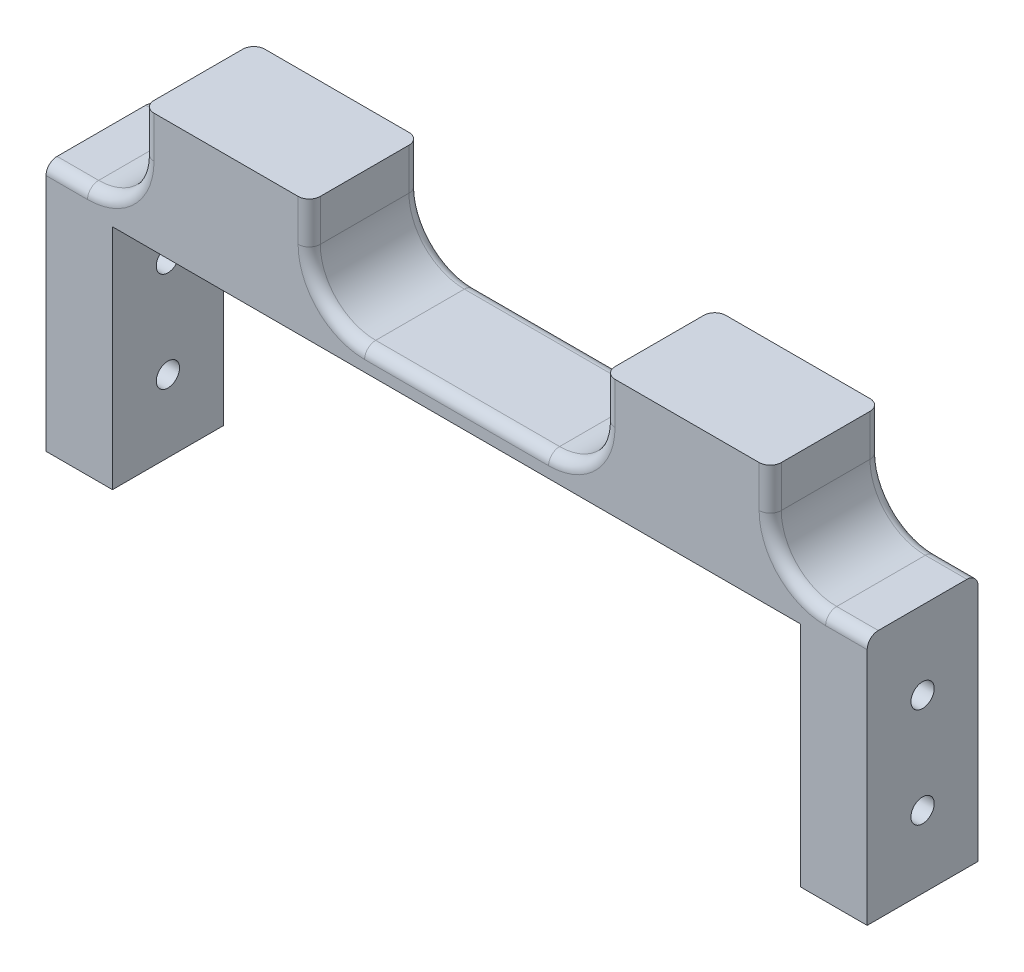
from build123d import *

# Parameters (mm, degrees)
BOSS_EXTRUDE1_DEPTH  = 20
SKETCH2_R            = 2.1
CUT_EXTRUDE1_DEPTH   = 149
SKETCH3_W            = 30
SKETCH3_H            = 17.5
BOSS_EXTRUDE2_DEPTH  = 20
FILLET1_R            = 10
FILLET1_OF_MIRROR1_R = 10
FILLET2_R            = 2


with BuildPart() as part:
    # Sketch1 → Boss-Extrude1 (new body)
    with BuildSketch(Plane.XY):
        Polygon((62.1, 20.55), (62.1, -20.55), (74.1, -20.55), (74.1, 24.55), (-74.1, 24.55), (-74.1, -20.55), (-62.1, -20.55), (-62.1, 20.55), align=None)
    extrude(amount=BOSS_EXTRUDE1_DEPTH)

    # Sketch2 → Cut-Extrude1 (cut)
    with BuildSketch(Plane.ZY.offset(74.1)):
        with Locations((10, 10.45)):
            Circle(SKETCH2_R)
        with Locations((10, -7.55)):
            Circle(SKETCH2_R)
    extrude(amount=-CUT_EXTRUDE1_DEPTH, mode=Mode.SUBTRACT)

    # Sketch3 → Boss-Extrude2 (add)
    with BuildSketch(Plane.XY.offset(20)):
        with Locations((-41.6, 33.3)):
            Rectangle(SKETCH3_W, SKETCH3_H)
    boss_extrude2 = extrude(amount=-BOSS_EXTRUDE2_DEPTH)

    # Fillet1
    fillet1_edges = [part.edges().sort_by_distance(p)[0] for p in [
        (-26.6, 24.55, 10),
        (-56.6, 24.55, 10),
    ]]
    fillet(fillet1_edges, radius=FILLET1_R)

    # Mirror1: Boss-Extrude2 across plane
    add(boss_extrude2.mirror(Plane(origin=(0, 0, 0), x_dir=(0, 0, 1), z_dir=(1, 0, 0))))

    # Fillet1 of Mirror1
    fillet1_of_mirror1_edges = [part.edges().sort_by_distance(p)[0] for p in [
        (26.6, 24.55, 10),
        (56.6, 24.55, 10),
    ]]
    fillet(fillet1_of_mirror1_edges, radius=FILLET1_OF_MIRROR1_R)

    # Fillet2
    fillet2_edges = [part.edges().sort_by_distance(p)[0] for p in [
        (-56.6, 38.3, 0),
        (-59.528932188, 27.478932188, 0),
        (26.6, 38.3, 0),
        (23.671067812, 27.478932188, 0),
        (-26.6, 38.3, 0),
        (-23.671067812, 27.478932188, 0),
        (56.6, 38.3, 0),
        (70.35, 24.55, 0),
        (70.35, 24.55, 20),
        (56.6, 38.3, 20),
        (26.6, 38.3, 20),
        (23.671067812, 27.478932188, 20),
        (0, 24.55, 20),
        (-26.6, 38.3, 20),
        (-56.6, 38.3, 20),
        (-70.35, 24.55, 20),
        (-70.35, 24.55, 0),
        (0, 24.55, 0),
        (59.528932188, 27.478932188, 0),
        (59.528932188, 27.478932188, 20),
        (-23.671067812, 27.478932188, 20),
        (-59.528932188, 27.478932188, 20),
    ]]
    fillet(fillet2_edges, radius=FILLET2_R)


solid = part.part
